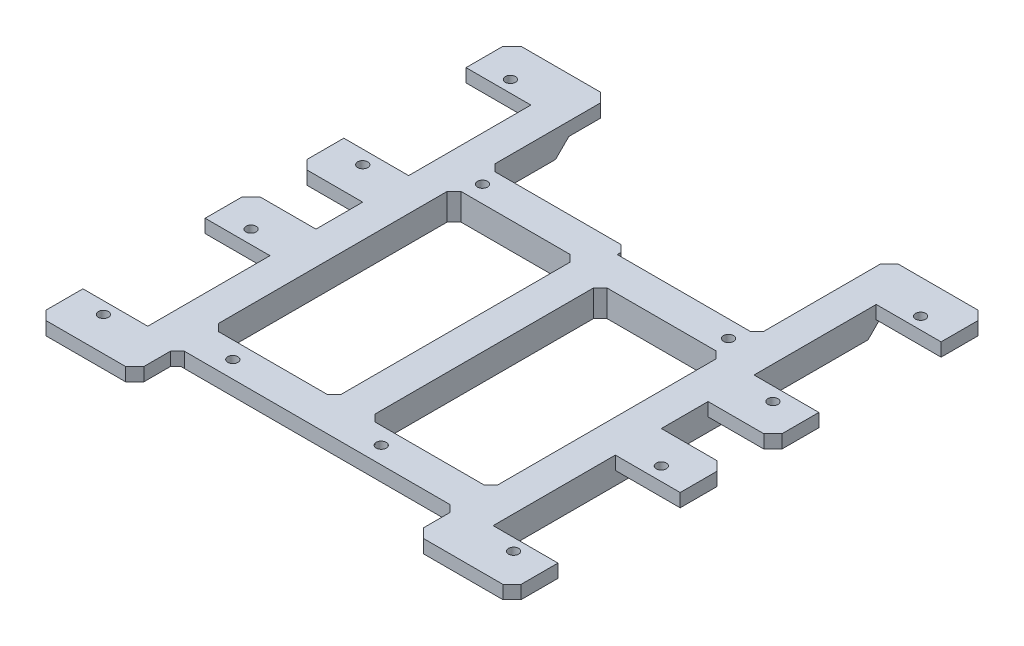
from build123d import *

# Parameters (mm, degrees)
SKETCH1_W               = 89.4
SKETCH1_H               = 89.4
SKETCH1_R               = 0.95
BOSS_EXTRUDE1_DEPTH     = 2.5
SKETCH5_W               = 65
SKETCH5_H               = 74
BOSS_EXTRUDE3_DEPTH     = 2.5
SKETCH7_R               = 0.95
CUT_EXTRUDE2_DEPTH      = 4
CUT_EXTRUDE1_DEPTH      = 64.412774738
CUT_EXTRUDE1_DEPTH_BACK = 64.412774738
SKETCH2_W               = 12.2
SKETCH2_H               = 23
SKETCH2_W_2             = 52.6
SKETCH2_H_2             = 8.025
SKETCH2_W_3             = 23.1
SKETCH2_H_3             = 45.67
SKETCH2_H_4             = 43.68
SKETCH2_H_5             = 8.8
CHAMFER2_SIZE           = 1.3
CHAMFER3_SIZE           = 1.3
CHAMFER4_SIZE           = 1.7
CHAMFER5_SIZE           = 2.5


with BuildPart() as part:
    # Sketch1 → Boss-Extrude1 (new body)
    with BuildSketch(Plane(origin=(0, 0, 0), x_dir=(1, 0, 0), z_dir=(0, 1, 0))):
        Rectangle(SKETCH1_W, SKETCH1_H)
        with Locations(Location((-38.6, 38.3, 0), (0, 0, 270))):
            Circle(SKETCH1_R, mode=Mode.SUBTRACT)
        with Locations(Location((-38.6, 10.5, 0), (0, 0, 270))):
            Circle(SKETCH1_R, mode=Mode.SUBTRACT)
        with Locations(Location((-38.6, -10.5, 0), (0, 0, 270))):
            Circle(SKETCH1_R, mode=Mode.SUBTRACT)
        with Locations(Location((-38.6, -38.3, 0), (0, 0, 270))):
            Circle(SKETCH1_R, mode=Mode.SUBTRACT)
        with Locations(Location((38.6, -38.3, 0), (0, 0, 90))):
            Circle(SKETCH1_R, mode=Mode.SUBTRACT)
        with Locations(Location((38.6, -10.5, 0), (0, 0, 90))):
            Circle(SKETCH1_R, mode=Mode.SUBTRACT)
        with Locations(Location((38.6, 10.5, 0), (0, 0, 90))):
            Circle(SKETCH1_R, mode=Mode.SUBTRACT)
        with Locations(Location((38.6, 38.3, 0), (0, 0, 90))):
            Circle(SKETCH1_R, mode=Mode.SUBTRACT)
    extrude(amount=BOSS_EXTRUDE1_DEPTH)

    # Sketch5 → Boss-Extrude3 (add)
    with BuildSketch(Plane.XZ):
        Rectangle(SKETCH5_W, SKETCH5_H)
    extrude(amount=BOSS_EXTRUDE3_DEPTH)

    # Sketch7 → Cut-Extrude2 (cut)
    with BuildSketch(Plane(origin=(0, 2.5, 0), x_dir=(1, 0, 0), z_dir=(0, 1, 0))):
        with Locations(Location((-24.15, 18.595, 0), (0, 0, 270))):
            Circle(SKETCH7_R)
        with Locations(Location((24.15, 16.605, 0), (0, 0, 270))):
            Circle(SKETCH7_R)
        with Locations(Location((-19.07, -33.475, 0), (0, 0, 270))):
            Circle(SKETCH7_R)
        with Locations(Location((8.86, -33.475, 0), (0, 0, 270))):
            Circle(SKETCH7_R)
    extrude(amount=-CUT_EXTRUDE2_DEPTH, mode=Mode.SUBTRACT)

    # Sketch2 → Cut-Extrude1 (cut, two sides: drawn at the far end of the back side and taken through both)
    with BuildSketch(Plane(origin=(0, 2.5, 0), x_dir=(1, 0, 0), z_dir=(0, 1, 0)).offset(-CUT_EXTRUDE1_DEPTH_BACK)):
        with Locations((-38.6, 24.55)):
            Rectangle(SKETCH2_W, SKETCH2_H)
        Polygon((-26.3, 44.7), (26.3, 44.7), (26.3, 24.23), (26.3, 19.805), (0, 19.805), (0, 21.795), (-26.3, 21.795), align=None)
        with Locations((0, -40.6875)):
            Rectangle(SKETCH2_W_2, SKETCH2_H_2)
        with Locations((-14.75, -7.44)):
            Rectangle(SKETCH2_W_3, SKETCH2_H_3)
        with Locations((14.75, -8.435)):
            Rectangle(SKETCH2_W_3, SKETCH2_H_4)
        with Locations((-38.6, 0)):
            Rectangle(SKETCH2_W, SKETCH2_H_5)
        with Locations((38.6, 0)):
            Rectangle(SKETCH2_W, SKETCH2_H_5)
        with Locations((38.6, 24.55)):
            Rectangle(SKETCH2_W, SKETCH2_H)
        with Locations((38.6, -24.55)):
            Rectangle(SKETCH2_W, SKETCH2_H)
        with Locations((-38.6, -24.55)):
            Rectangle(SKETCH2_W, SKETCH2_H)
    extrude(amount=CUT_EXTRUDE1_DEPTH + CUT_EXTRUDE1_DEPTH_BACK, mode=Mode.SUBTRACT)

    # Chamfer2
    chamfer2_edges = [part.edges().sort_by_distance(p)[0] for p in [
        (0, 0, -21.795),
    ]]
    chamfer(chamfer2_edges, length=CHAMFER2_SIZE)

    # Chamfer3
    chamfer3_edges = [part.edges().sort_by_distance(p)[0] for p in [
        (-26.3, 0, -21.795),
        (26.3, 0, 36.675),
        (-26.3, 0, 36.675),
        (-26.3, 0, 30.275),
        (-3.2, 0, 30.275),
        (3.2, 0, 30.275),
        (26.3, 0, 30.275),
        (-3.2, 0, -15.395),
        (3.2, 0, -13.405),
        (26.3, 0, -13.405),
        (26.3, 0, -19.805),
        (-26.3, 0, -15.395),
    ]]
    chamfer(chamfer3_edges, length=CHAMFER3_SIZE)

    # Chamfer4
    chamfer4_edges = [part.edges().sort_by_distance(p)[0] for p in [
        (26.3, 1.25, 44.7),
        (-26.3, 1.25, 44.7),
        (-44.7, 1.25, 4.4),
        (-44.7, 1.25, -4.4),
        (-26.3, 1.25, -44.7),
        (26.3, 1.25, -44.7),
        (44.7, 1.25, -4.4),
        (44.7, 1.25, 4.4),
        (-44.7, 1.25, -44.7),
        (44.7, 1.25, -44.7),
        (44.7, 1.25, 44.7),
        (-44.7, 1.25, 44.7),
    ]]
    chamfer(chamfer4_edges, length=CHAMFER4_SIZE)

    # Chamfer5
    chamfer5_edges = [part.edges().sort_by_distance(p)[0] for p in [
        (28.9125, -2.5, 37),
        (29.4, -2.5, -37),
        (-29.4, -2.5, -37),
    ]]
    chamfer(chamfer5_edges, length=CHAMFER5_SIZE - 0.0001)  # a hair under: the kernel refuses the full size


solid = part.part
